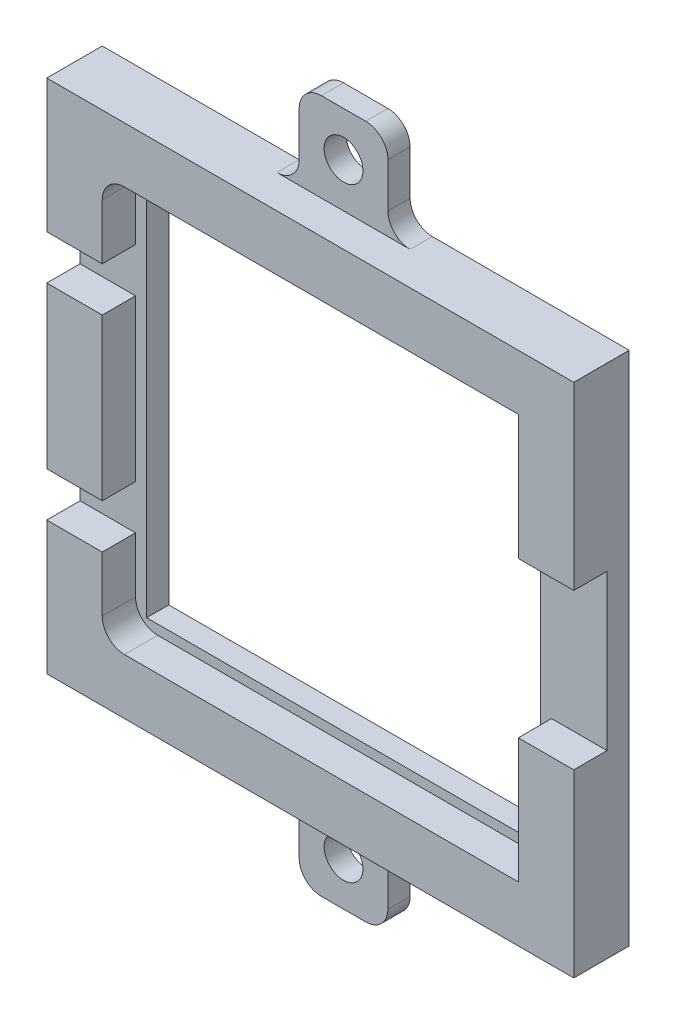
from build123d import *

# Parameters (mm, degrees)
SKETCH1_W                 = 37.5
SKETCH1_H                 = 36.5
BOSS_EXTRUDE1_DEPTH       = 5
SHELL1_T                  = 5
BOSS_EXTRUDE2_START       = -2
BOSS_EXTRUDE2_OUTLINE_W   = 8
BOSS_EXTRUDE2_OUTLINE_H   = 8
BOSS_EXTRUDE2_OUTLINE_R   = 1.75
BOSS_EXTRUDE2_OUTLINE_W_2 = 37.5
BOSS_EXTRUDE2_OUTLINE_H_2 = 36.5
BOSS_EXTRUDE2_OUTLINE_W_3 = 35.5
BOSS_EXTRUDE2_OUTLINE_H_3 = 34.752631578
BOSS_EXTRUDE2_DEPTH       = 2
SKETCH3_W                 = 5
SKETCH3_H                 = 4
SKETCH3_H_2               = 14
CUT_EXTRUDE2_DEPTH        = 3
FILLET1_R                 = 2


# Read off the part's stored shape, not the designer's step: Boss-Extrude2
with BuildPart() as part:
    # Sketch1 → Boss-Extrude1 (new body)
    with BuildSketch(Plane.XY):
        with Locations((18.75, -18.25)):
            Rectangle(SKETCH1_W, SKETCH1_H)
    extrude(amount=BOSS_EXTRUDE1_DEPTH)

    # Shell1
    shell1_openings = [part.faces().sort_by_distance(p)[0] for p in [
        (18.75, -18.25, 0),
        (18.75, -18.25, 5),
    ]]
    offset(amount=SHELL1_T, openings=shell1_openings, kind=Kind.INTERSECTION)

    # Boss-Extrude2 outline → Boss-Extrude2 (add)
    # profile 1 of 3: a face of its own
    with BuildSketch(Plane(origin=(0, 0, 0), x_dir=(-1, 0, 0), z_dir=(0, 0, -1)).offset(BOSS_EXTRUDE2_START)):
        with Locations((-18.75, 9)):
            Rectangle(BOSS_EXTRUDE2_OUTLINE_W, BOSS_EXTRUDE2_OUTLINE_H)
        with Locations((-18.75, 9)):
            Circle(BOSS_EXTRUDE2_OUTLINE_R, mode=Mode.SUBTRACT)
    # profile 2 of 3: a face of its own
    with BuildSketch(Plane(origin=(0, 0, 0), x_dir=(-1, 0, 0), z_dir=(0, 0, -1)).offset(BOSS_EXTRUDE2_START)):
        with Locations((-18.75, -45.5)):
            Rectangle(BOSS_EXTRUDE2_OUTLINE_W, BOSS_EXTRUDE2_OUTLINE_H)
        with Locations((-18.75, -45.5)):
            Circle(BOSS_EXTRUDE2_OUTLINE_R, mode=Mode.SUBTRACT)
    # profile 3 of 3: a face of its own
    with BuildSketch(Plane(origin=(0, 0, 0), x_dir=(-1, 0, 0), z_dir=(0, 0, -1)).offset(BOSS_EXTRUDE2_START)):
        with Locations((-18.75, -18.25)):
            Rectangle(BOSS_EXTRUDE2_OUTLINE_W_2, BOSS_EXTRUDE2_OUTLINE_H_2)
        with Locations((-18.75, -18.25)):
            Rectangle(BOSS_EXTRUDE2_OUTLINE_W_3, BOSS_EXTRUDE2_OUTLINE_H_3, mode=Mode.SUBTRACT)
    extrude(amount=BOSS_EXTRUDE2_DEPTH)

    # Sketch3 → Cut-Extrude2 (cut)
    with BuildSketch(Plane.XY.offset(5)):
        with Locations((-2.5, -9)):
            Rectangle(SKETCH3_W, SKETCH3_H)
        with Locations((-2.5, -27.5)):
            Rectangle(SKETCH3_W, SKETCH3_H)
        with Locations((40, -18.25)):
            Rectangle(SKETCH3_W, SKETCH3_H_2)
    extrude(amount=-CUT_EXTRUDE2_DEPTH, mode=Mode.SUBTRACT)

    # Fillet1
    fillet1_edges = [part.edges().sort_by_distance(p)[0] for p in [
        (0, 0, 3.5),
        (0, -36.5, 3.5),
        (22.75, -41.5, 1),
        (22.75, 5, 1),
        (22.75, 13, 1),
        (14.75, 13, 1),
        (14.75, 5, 1),
        (14.75, -41.5, 1),
        (14.75, -49.5, 1),
        (22.75, -49.5, 1),
    ]]
    fillet(fillet1_edges, radius=FILLET1_R)


solid = part.part
